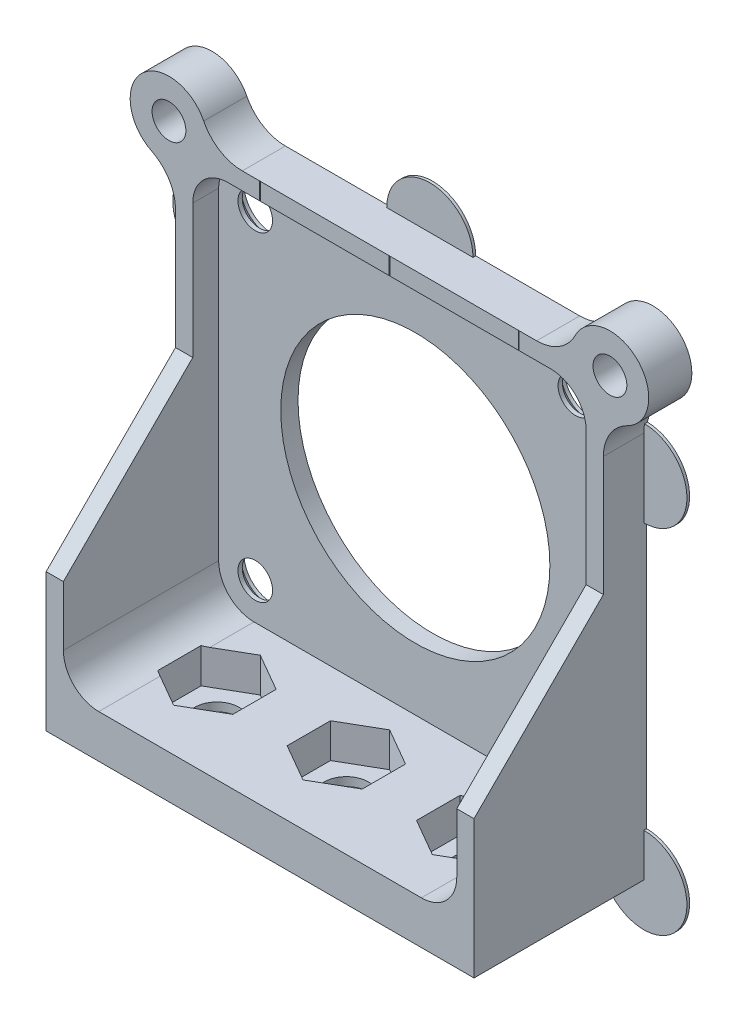
from build123d import *
from build123d.topology import SkipClean

# Parameters (mm, degrees)
SKETCH3_R                                     = 19.812
SKETCH3_R_2                                   = 2.55
BOSS_EXTRUDE1_DEPTH                           = 2.54
BOSS_EXTRUDE6_DEPTH                           = 3.81
BOSS_EXTRUDE10_DEPTH                          = 22.86
BOSS_EXTRUDE10_DEPTH_BACK                     = 2.54
CHAMFER1_SIZE                                 = 20.32
CUT_EXTRUDE2_DEPTH                            = 5.08
CUT_EXTRUDE2_DEPTH_BACK                       = 73.755970889
F_1_4_CLEARANCE_HOLE1_D                       = 6.5278
SKETCH22_R                                    = 2.413
BOSS_EXTRUDE18_DEPTH                          = 6.35
FILLET1_R                                     = 6.35
CSK_FOR_FLAT_HEAD_MACHINE_SCREW_100_1_A_COUNT = 2
CSK_FOR_FLAT_HEAD_MACHINE_SCREW_100_1_A_PITCH = 47.14
CSK_FOR_FLAT_HEAD_MACHINE_SCREW_100_2_COUNT   = 2
CSK_FOR_FLAT_HEAD_MACHINE_SCREW_100_2_PITCH   = 66.66602733
CSK_FOR_FLAT_HEAD_MACHINE_SCREW_100_3_COUNT   = 2
CSK_FOR_FLAT_HEAD_MACHINE_SCREW_100_3_PITCH   = 47.14
F_10_CLEARANCE_HOLE1_D                        = 4.9784
SKETCH6_R                                     = 6.35
TABS_DEPTH                                    = 0.4


with BuildPart() as part:
    # Sketch3 → Boss-Extrude1 (new body)
    with BuildSketch(Plane.XY):
        with BuildLine():
            Line((23.755, 31.502), (-23.755, 31.502))
            ThreePointArc((-23.755, 31.502), (-29.232956234, 29.232956234), (-31.502, 23.755))
            Line((-31.502, 23.755), (-31.502, -23.755))
            ThreePointArc((-31.502, -23.755), (-29.232956234, -29.232956234), (-23.755, -31.502))
            Line((-23.755, -31.502), (23.755, -31.502))
            ThreePointArc((23.755, -31.502), (29.232956234, -29.232956234), (31.502, -23.755))
            Line((31.502, -23.755), (31.502, 23.755))
            ThreePointArc((31.502, 23.755), (29.232956234, 29.232956234), (23.755, 31.502))
        make_face()
        Circle(SKETCH3_R, mode=Mode.SUBTRACT)
        with Locations((23.57, 23.57)):
            Circle(SKETCH3_R_2, mode=Mode.SUBTRACT)
        with Locations((-23.57, 23.57)):
            Circle(SKETCH3_R_2, mode=Mode.SUBTRACT)
        with Locations((-23.57, -23.57)):
            Circle(SKETCH3_R_2, mode=Mode.SUBTRACT)
        with Locations((23.57, -23.57)):
            Circle(SKETCH3_R_2, mode=Mode.SUBTRACT)
    extrude(amount=BOSS_EXTRUDE1_DEPTH)

    # Sketch16 → Boss-Extrude6 (add)
    with BuildSketch(Plane.XY.offset(2.54)):
        with BuildLine():
            Line((23.755, 31.502), (-23.755, 31.502))
            ThreePointArc((-23.755, 31.502), (-29.232956234, 29.232956234), (-31.502, 23.755))
            Line((-31.502, 23.755), (-31.502, -23.755))
            ThreePointArc((-31.502, -23.755), (-29.232956234, -29.232956234), (-23.755, -31.502))
            Line((-23.755, -31.502), (23.755, -31.502))
            ThreePointArc((23.755, -31.502), (29.232956234, -29.232956234), (31.502, -23.755))
            Line((31.502, -23.755), (31.502, 23.755))
            ThreePointArc((31.502, 23.755), (29.232956234, 29.232956234), (23.755, 31.502))
        make_face()
        with BuildLine():
            Line((23.755, 28.962), (-23.755, 28.962))
            ThreePointArc((-23.755, 28.962), (-27.43690501, 27.43690501), (-28.962, 23.755))
            Line((-28.962, 23.755), (-28.962, -23.755))
            ThreePointArc((-28.962, -23.755), (-27.43690501, -27.43690501), (-23.755, -28.962))
            Line((-23.755, -28.962), (23.755, -28.962))
            ThreePointArc((23.755, -28.962), (27.43690501, -27.43690501), (28.962, -23.755))
            Line((28.962, -23.755), (28.962, 23.755))
            ThreePointArc((28.962, 23.755), (27.43690501, 27.43690501), (23.755, 28.962))
        make_face(mode=Mode.SUBTRACT)
    extrude(amount=BOSS_EXTRUDE6_DEPTH)

    # Sketch17 → Boss-Extrude10 (add, two sides: drawn at the far end of the back side and taken through both)
    with SkipClean():  # the faces are left unmerged after this step: merging them gives an invalid solid
        with BuildSketch(Plane.XY.offset(2.54).offset(-BOSS_EXTRUDE10_DEPTH_BACK)):
            with BuildLine():
                Line((-31.502, -35.312), (31.502, -35.312))
                Line((31.502, -35.312), (31.502, -16.262))
                Line((31.502, -16.262), (28.962, -16.262))
                Line((28.962, -16.262), (28.962, -23.755))
                ThreePointArc((28.962, -23.755), (27.43690501, -27.43690501), (23.755, -28.962))
                Line((23.755, -28.962), (-23.755, -28.962))
                ThreePointArc((-23.755, -28.962), (-27.43690501, -27.43690501), (-28.962, -23.755))
                Line((-28.962, -23.755), (-28.962, -16.262))
                Line((-28.962, -16.262), (-31.502, -16.262))
                Line((-31.502, -16.262), (-31.502, -35.312))
            make_face()
        extrude(amount=BOSS_EXTRUDE10_DEPTH + BOSS_EXTRUDE10_DEPTH_BACK)
    add(part.part.scale(1), mode=Mode.REPLACE)  # the faces are merged on a copy

    # Chamfer1
    # the kernel refuses this chamfer: 20.32 mm, written as the material it adds along each edge
    with BuildSketch(Plane(origin=(28.962, -16.262, 6.35), x_dir=(0, -0.02749587661058643, 0.9996219169112968), z_dir=(1, 0, 0))) as chamfer1_piece_1_section:
        Polygon((CHAMFER1_SIZE * 0.999621916911, -CHAMFER1_SIZE * 0.0274958766106), (-CHAMFER1_SIZE * 0.0274958766106, -CHAMFER1_SIZE * 0.999621916911), (0, 0), align=None)
    chamfer1_piece_1 = extrude(amount=2.54, mode=Mode.PRIVATE)
    chamfer1_piece_1 = split(chamfer1_piece_1, bisect_by=Plane(origin=(30.232, -9.48984053, 25.4), z_dir=(0, 0, -1)), keep=Keep.TOP, mode=Mode.PRIVATE)
    add(chamfer1_piece_1)
    with BuildSketch(Plane(origin=(-31.502, -16.262, 6.35), x_dir=(0, -0.02749587661058643, 0.9996219169112968), z_dir=(1, 0, 0))) as chamfer1_piece_2_section:
        Polygon((CHAMFER1_SIZE * 0.999621916911, -CHAMFER1_SIZE * 0.0274958766106), (-CHAMFER1_SIZE * 0.0274958766106, -CHAMFER1_SIZE * 0.999621916911), (0, 0), align=None)
    chamfer1_piece_2 = extrude(amount=2.54, mode=Mode.PRIVATE)
    chamfer1_piece_2 = split(chamfer1_piece_2, bisect_by=Plane(origin=(-30.232, -9.48984053, 25.4), z_dir=(0, 0, -1)), keep=Keep.TOP, mode=Mode.PRIVATE)
    add(chamfer1_piece_2)

    # Sketch18 → Cut-Extrude2 (cut, two sides: drawn at the far end of the back side and taken through both)
    with BuildSketch(Plane.XZ.offset(28.962).offset(-CUT_EXTRUDE2_DEPTH_BACK)):
        Polygon((0, 19.079143124), (-5.5245, 15.889571562), (-5.5245, 9.510428438), (0, 6.320856876), (5.5245, 9.510428438), (5.5245, 15.889571562), align=None)
        Polygon((-24.5745, 15.889571562), (-19.05, 19.079143124), (-13.5255, 15.889571562), (-13.5255, 9.510428438), (-19.05, 6.320856876), (-24.5745, 9.510428438), align=None)
        Polygon((19.05, 19.079143124), (13.5255, 15.889571562), (13.5255, 9.510428438), (19.05, 6.320856876), (24.5745, 9.510428438), (24.5745, 15.889571562), align=None)
    extrude(amount=CUT_EXTRUDE2_DEPTH + CUT_EXTRUDE2_DEPTH_BACK, mode=Mode.SUBTRACT)

    # 1/4 Clearance Hole1 (through all)
    with Locations(Plane(origin=(0, -34.042, 0), x_dir=(1, 0, 0), z_dir=(0, 1, 0))):
        with Locations((-19.05, -12.7), (0, -12.7), (19.05, -12.7)):
            Hole(F_1_4_CLEARANCE_HOLE1_D / 2)

    # Sketch22 → Boss-Extrude18 (add)
    with BuildSketch(Plane(origin=(0, 0, 0), x_dir=(-1, 0, 0), z_dir=(0, 0, -1))):
        with BuildLine():
            ThreePointArc((-27.002557269, 30.78844729), (-26.814125955, 31.617757649), (-26.750848437, 32.465848437))
            ThreePointArc((-26.750848437, 32.465848437), (-37.061910478, 35.862528982), (-30.78844729, 27.002557269))
            ThreePointArc((-30.78844729, 27.002557269), (-29.232956234, 29.232956234), (-27.002557269, 30.78844729))
        make_face()
        with Locations((-32.465848437, 32.465848437)):
            Circle(SKETCH22_R, mode=Mode.SUBTRACT)
    boss_extrude18 = extrude(amount=-BOSS_EXTRUDE18_DEPTH)

    # Mirror3: Boss-Extrude18 across plane
    add(boss_extrude18.mirror(Plane(origin=(0, 0, 0), x_dir=(0, 0, 1), z_dir=(1, 0, 0))))

    # Fillet1
    fillet1_edges = [part.edges().sort_by_distance(p)[0] for p in [
        (27.002557269, 30.78844729, 3.175),
        (30.78844729, 27.002557269, 3.175),
        (-27.002557269, 30.78844729, 3.175),
        (-30.78844729, 27.002557269, 3.175),
    ]]
    fillet(fillet1_edges, radius=FILLET1_R)

    # Sketch23 → CSK for  Flat Head Machine Screw (100)1 (revolve, cut)
    with BuildSketch(Plane(origin=(23.57, 23.57, 0), x_dir=(0, 1, 0), z_dir=(1, 0, 0))):
        Polygon((0, 0), (0, 25.4), (2.4892, 25.4), (2.4892, 1.957292137), (4.216399111, 0.508), (4.216399111, 0), align=None)
    csk_for_flat_head_machine_screw_100_1 = revolve(axis=Axis((23.57, 23.57, -6.35), (0, 0, 1)), mode=Mode.SUBTRACT)

    # CSK for  Flat Head Machine Screw (100)1 a: CSK for  Flat Head Machine Screw (100)1 ×2
    with Locations(*[(-i * CSK_FOR_FLAT_HEAD_MACHINE_SCREW_100_1_A_PITCH, 0, 0) for i in range(1, CSK_FOR_FLAT_HEAD_MACHINE_SCREW_100_1_A_COUNT)]):
        add(csk_for_flat_head_machine_screw_100_1, mode=Mode.SUBTRACT)

    # CSK for Flat Head Machine Screw _100 2: CSK for  Flat Head Machine Screw (100)1 ×2
    with Locations(*[Vector(-0.7071067811865476, -0.7071067811865476, 0) * (i * CSK_FOR_FLAT_HEAD_MACHINE_SCREW_100_2_PITCH) for i in range(1, CSK_FOR_FLAT_HEAD_MACHINE_SCREW_100_2_COUNT)]):
        add(csk_for_flat_head_machine_screw_100_1, mode=Mode.SUBTRACT)

    # CSK for Flat Head Machine Screw _100 3: CSK for  Flat Head Machine Screw (100)1 ×2
    with Locations(*[(0, -i * CSK_FOR_FLAT_HEAD_MACHINE_SCREW_100_3_PITCH, 0) for i in range(1, CSK_FOR_FLAT_HEAD_MACHINE_SCREW_100_3_COUNT)]):
        add(csk_for_flat_head_machine_screw_100_1, mode=Mode.SUBTRACT)

    # #10 Clearance Hole1 (through all)
    with Locations(Plane(origin=(0, 0, 0), x_dir=(-1, 0, 0), z_dir=(0, 0, -1))):
        with Locations((-32.465848437, 32.465848437), (32.465848437, 32.465848437)):
            Hole(F_10_CLEARANCE_HOLE1_D / 2)

    # Sketch6 → Tabs (add)
    with BuildSketch(Plane(origin=(0, -30.232, 0), x_dir=(-1, 0, 0), z_dir=(0, 0, -1))):
        with Locations((31.502, -5.08)):
            Circle(SKETCH6_R)
        with Locations((-31.502, -5.08)):
            Circle(SKETCH6_R)
        with Locations((-31.502, 46.821157202)):
            Circle(SKETCH6_R)
        with Locations((31.502, 46.821157202)):
            Circle(SKETCH6_R)
        with Locations((0, 61.734)):
            Circle(SKETCH6_R)
    extrude(amount=-TABS_DEPTH)


solid = part.part
